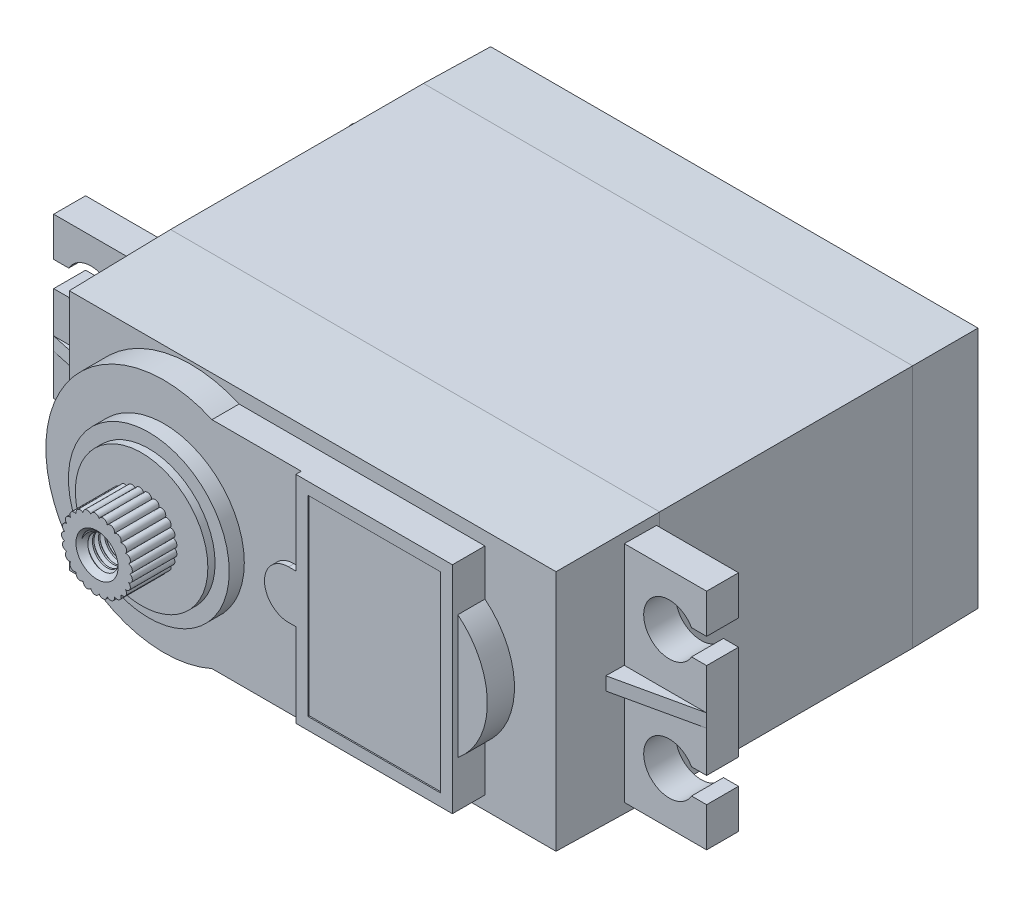
from build123d import *
from OCP.BRepFilletAPI import BRepFilletAPI_MakeChamfer

# Parameters (mm, degrees)
SKETCH1_W                 = 40.6
SKETCH1_H                 = 20.3
MAINCASE_DEPTH            = 37
FLANGE_START              = -5.6
FLANGE_DEPTH              = 2.65
TOPFACE_DEPTH             = 2.25
SKETCH2_3_R               = 6.675
BOSS_EXTRUDE4_DEPTH       = 3.5
SKETCH2_4_R               = 5.5
BOSS_EXTRUDE5_DEPTH       = 4.1
BOSS_EXTRUDE6_DEPTH       = 2.7
SKETCH2_8_W               = 11
SKETCH2_8_H               = 7.95
BOSS_EXTRUDE7_DEPTH       = 2.6
SKETCH3_R                 = 1.25
BOSS_EXTRUDE9_DEPTH       = 7.8
SKETCH3_4_R               = 1.25
BOSS_EXTRUDE10_DEPTH      = 3.7
BOSS_EXTRUDE11_DEPTH      = 0.55
BOSS_EXTRUDE11_DEPTH_BACK = 0.55
CHAMFER1_SIZE             = 0.5
THREAD1_PITCH             = 0.5
CHAMFER2_SIZE             = 7.5
CHAMFER2_SIZE2            = 0.1
CHAMFER3_SIZE             = 2
CHAMFER3_SIZE2            = 2.027207199
CHAMFER4_SIZE             = 8.5
CHAMFER4_SIZE_2           = 0.1
BOSS_EXTRUDE12_DEPTH      = 5
BOSS_EXTRUDE12_DEPTH_BACK = 1
BOSS_EXTRUDE13_DEPTH      = 8
CHAMFER5_SIZE             = 4
CHAMFER5_SIZE2            = 0.3


with BuildPart() as part:
    # Sketch1 → MainCase (new body)
    with BuildSketch(Plane.XY):
        with Locations((10.1, 0)):
            Rectangle(SKETCH1_W, SKETCH1_H)
    extrude(amount=-MAINCASE_DEPTH)

    # Sketch1<3> → Flange (add)
    with BuildSketch(Plane.XY.offset(FLANGE_START)):
        with BuildLine():
            Line((-17, 9.3), (37.2, 9.3))
            Line((37.2, 9.3), (37.2, 6.05))
            Line((37.2, 6.05), (35.947464479, 6.05))
            ThreePointArc((35.947464479, 6.05), (31.975, 5), (35.947464479, 3.95))
            Line((35.947464479, 3.95), (37.2, 3.95))
            Line((37.2, 3.95), (37.2, -3.95))
            Line((37.2, -3.95), (35.947464479, -3.95))
            ThreePointArc((35.947464479, -3.95), (31.975, -5), (35.947464479, -6.05))
            Line((35.947464479, -6.05), (37.2, -6.05))
            Line((37.2, -6.05), (37.2, -9.3))
            Line((37.2, -9.3), (-17, -9.3))
            Line((-17, -9.3), (-17, -6.05))
            Line((-17, -6.05), (-15.747464479, -6.05))
            ThreePointArc((-15.747464479, -6.05), (-11.775, -5), (-15.747464479, -3.95))
            Line((-15.747464479, -3.95), (-17, -3.95))
            Line((-17, -3.95), (-17, 3.95))
            Line((-17, 3.95), (-15.747464479, 3.95))
            ThreePointArc((-15.747464479, 3.95), (-11.775, 5), (-15.747464479, 6.05))
            Line((-15.747464479, 6.05), (-17, 6.05))
            Line((-17, 6.05), (-17, 9.3))
        make_face()
    extrude(amount=-FLANGE_DEPTH)

    # Sketch2 → TopFace (add)
    with BuildSketch(Plane.XY):
        with BuildLine():
            Line((3.992179856, 8.95), (24.4, 8.95))
            Line((24.4, 8.95), (24.4, 5.132007405))
            ThreePointArc((24.4, 5.132007405), (26.85, 0), (24.4, -5.132007405))
            Line((24.4, -5.132007405), (24.4, -8.95))
            Line((24.4, -8.95), (3.992179856, -8.95))
            ThreePointArc((3.992179856, -8.95), (-9.8, 0), (3.992179856, 8.95))
        make_face()
    extrude(amount=TOPFACE_DEPTH)

    # Sketch2<3> → Boss-Extrude4 (add)
    with BuildSketch(Plane.XY):
        Circle(SKETCH2_3_R)
    extrude(amount=BOSS_EXTRUDE4_DEPTH)

    # Sketch2<4> → Boss-Extrude5 (add)
    with BuildSketch(Plane.XY):
        Circle(SKETCH2_4_R)
    extrude(amount=BOSS_EXTRUDE5_DEPTH)

    # Sketch2<7> → Boss-Extrude6 (add)
    with BuildSketch(Plane.XY):
        with BuildLine():
            Line((24.4, 8.95), (11.4, 8.95))
            Line((11.4, 8.95), (11.4, 2))
            Line((11.4, 2), (10.8, 2))
            ThreePointArc((10.8, 2), (9.385786438, 1.414213562), (8.8, 0))
            Line((8.8, 0), (12.4, 0))
            Line((12.4, 0), (12.4, 7.95))
            Line((12.4, 7.95), (23.4, 7.95))
            Line((23.4, 7.95), (23.4, 0))
            Line((23.4, 0), (24.4, 0))
            Line((24.4, 0), (24.4, 5.132007405))
            Line((24.4, 5.132007405), (24.4, 8.95))
        make_face()
        with BuildLine():
            Line((11.4, -2), (11.4, -8.95))
            Line((11.4, -8.95), (24.4, -8.95))
            Line((24.4, -8.95), (24.4, -5.132007405))
            Line((24.4, -5.132007405), (24.4, 0))
            Line((24.4, 0), (23.4, 0))
            Line((23.4, 0), (23.4, -7.95))
            Line((23.4, -7.95), (12.4, -7.95))
            Line((12.4, -7.95), (12.4, 0))
            Line((12.4, 0), (8.8, 0))
            ThreePointArc((8.8, 0), (9.385786438, -1.414213562), (10.8, -2))
            Line((10.8, -2), (11.4, -2))
        make_face()
    extrude(amount=BOSS_EXTRUDE6_DEPTH)

    # Sketch2<8> → Boss-Extrude7 (add)
    with BuildSketch(Plane.XY):
        with Locations((17.9, 3.975)):
            Rectangle(SKETCH2_8_W, SKETCH2_8_H)
        with Locations((17.9, -3.975)):
            Rectangle(SKETCH2_8_W, SKETCH2_8_H)
    extrude(amount=BOSS_EXTRUDE7_DEPTH)

    # Sketch3 → Boss-Extrude9 (add)
    with BuildSketch(Plane.XY):
        with BuildLine():
            ThreePointArc((-2.678709694, 0.338399731), (-2.95, 0), (-2.678709694, -0.338399731))
            ThreePointArc((-2.678709694, -0.338399731), (-2.857320325, -0.733635167), (-2.510396512, -0.993936292))
            ThreePointArc((-2.510396512, -0.993936292), (-2.585104706, -1.421173339), (-2.184345885, -1.587020181))
            ThreePointArc((-2.184345885, -1.587020181), (-2.150457451, -2.019413962), (-1.721044772, -2.080385755))
            ThreePointArc((-1.721044772, -2.080385755), (-1.580689045, -2.49076738), (-1.149604087, -2.443033042))
            ThreePointArc((-1.149604087, -2.443033042), (-0.911600133, -2.805616723), (-0.505929549, -2.652175577))
            ThreePointArc((-0.505929549, -2.652175577), (-0.185232033, -2.944178849), (0.169534403, -2.694672167))
            ThreePointArc((0.169534403, -2.694672167), (0.552774878, -2.89774739), (0.834345885, -2.567852594))
            ThreePointArc((0.834345885, -2.567852594), (1.25604891, -2.669239805), (1.446732346, -2.279685399))
            ThreePointArc((1.446732346, -2.279685399), (1.88040077, -2.273014066), (1.968215294, -1.848277186))
            ThreePointArc((1.968215294, -1.848277186), (2.386600133, -1.733966494), (2.366028036, -1.30073492))
            ThreePointArc((2.366028036, -1.30073492), (2.742840633, -1.08596743), (2.615174535, -0.671462695))
            ThreePointArc((2.615174535, -0.671462695), (2.926738369, -0.369733039), (2.7, 0))
            ThreePointArc((2.7, 0), (2.926738369, 0.369733039), (2.615174535, 0.671462695))
            ThreePointArc((2.615174535, 0.671462695), (2.742840633, 1.08596743), (2.366028036, 1.30073492))
            ThreePointArc((2.366028036, 1.30073492), (2.386600133, 1.733966494), (1.968215294, 1.848277186))
            ThreePointArc((1.968215294, 1.848277186), (1.88040077, 2.273014066), (1.446732346, 2.279685399))
            ThreePointArc((1.446732346, 2.279685399), (1.25604891, 2.669239805), (0.834345885, 2.567852594))
            ThreePointArc((0.834345885, 2.567852594), (0.552774878, 2.89774739), (0.169534403, 2.694672167))
            ThreePointArc((0.169534403, 2.694672167), (-0.185232033, 2.944178849), (-0.505929549, 2.652175577))
            ThreePointArc((-0.505929549, 2.652175577), (-0.911600133, 2.805616723), (-1.149604087, 2.443033042))
            ThreePointArc((-1.149604087, 2.443033042), (-1.580689045, 2.49076738), (-1.721044772, 2.080385755))
            ThreePointArc((-1.721044772, 2.080385755), (-2.150457451, 2.019413962), (-2.184345885, 1.587020181))
            ThreePointArc((-2.184345885, 1.587020181), (-2.585104706, 1.421173339), (-2.510396512, 0.993936292))
            ThreePointArc((-2.510396512, 0.993936292), (-2.857320325, 0.733635167), (-2.678709694, 0.338399731))
        make_face()
        Circle(SKETCH3_R, mode=Mode.SUBTRACT)
    extrude(amount=BOSS_EXTRUDE9_DEPTH)

    # Sketch3<4> → Boss-Extrude10 (add)
    with BuildSketch(Plane.XY):
        Circle(SKETCH3_4_R)
    extrude(amount=BOSS_EXTRUDE10_DEPTH)

    # Sketch7 → Boss-Extrude11 (add, two sides: drawn at the far end of the back side and taken through both)
    with BuildSketch(Plane(origin=(0, 0, 0), x_dir=(1, 0, 0), z_dir=(0, 1, 0)).offset(-BOSS_EXTRUDE11_DEPTH_BACK)):
        Polygon((-17, 5.6), (37.2, 5.6), (30.4, 4.1), (-10.2, 4.1), align=None)
    extrude(amount=BOSS_EXTRUDE11_DEPTH + BOSS_EXTRUDE11_DEPTH_BACK)

    # Chamfer1
    chamfer1_edges = [part.edges().sort_by_distance(p)[0] for p in [
        (-1.25, 0, 7.8),
    ]]
    chamfer(chamfer1_edges, length=CHAMFER1_SIZE)

    # Thread1: the profile of Thread Profile1 profile screwed along a right-hand helix of 8 turns, 6 arcs to a turn; built about Z, then put on its axis
    thread1_z = Axis((0, 0, 0), (0, 0, 1))
    thread1_corners = [(1.2497, 0, -0.000173205), (1.520632938, 0, 0.156249999), (1.520632937, 0, 0.218749999), (1.2497, 0, 0.375173204)]
    with BuildLine(mode=Mode.PRIVATE) as thread1_profile:
        Line(thread1_corners[0], thread1_corners[1])
        Line(thread1_corners[1], thread1_corners[2])
        Line(thread1_corners[2], thread1_corners[3])
        Line(thread1_corners[3], thread1_corners[0])
    thread1_cap = Face(thread1_profile.wire())
    thread1_turn_angles = [0, 30, 60, 90, 120, 150, 180, 210, 240, 270, 300, 330, 360]
    thread1_turn_weights = [1, 0.8660254037844387, 1, 0.8660254037844387, 1, 0.8660254037844387, 1, 0.8660254037844387, 1, 0.8660254037844387, 1, 0.8660254037844387, 1]
    thread1_turn_rails = [Edge.make_bspline([Vector(p[0], p[1], 0).rotate(thread1_z, thread1_turn_angles[k]) / thread1_turn_weights[k] + Vector(0, 0, p[2] + THREAD1_PITCH * thread1_turn_angles[k] / 360) for k in range(13)], [0, 0, 0, 1, 1, 2, 2, 3, 3, 4, 4, 5, 5, 6, 6, 6], 2, thread1_turn_weights) for p in thread1_corners]
    thread1_turn_sides = [Face.make_surface_from_curves(thread1_turn_rails[p[0]], thread1_turn_rails[p[1]]) for p in [(0, 1), (1, 2), (2, 3), (3, 0)]]
    thread1 = Plane(origin=(0, 0, 8.3), x_dir=(-1, 0, 0), z_dir=(0, 0, -1)) * Solid(Shell([*[p.moved(Location((0, 0, THREAD1_PITCH * i))) for i in range(8) for p in thread1_turn_sides], thread1_cap, thread1_cap.rotate(thread1_z, 2880).moved(Location((0, 0, THREAD1_PITCH * 2880 / 360)))]))
    add(thread1, mode=Mode.SUBTRACT)

    # Chamfer2: one chamfer whose edges measure the first distance from different faces: ONE call of the kernel's chamfer builder (chamfer() names one face for all edges)
    chamfer2_edges_1 = [part.edges().sort_by_distance(p)[0] for p in [
        (10.1, -10.15, -37),
    ]]
    chamfer2_side_1 = [part.faces().sort_by_distance(p)[0] for p in [
        (10.1, -10.15, -18.5),
    ]]
    chamfer2_edges_2 = [part.edges().sort_by_distance(p)[0] for p in [
        (-10.2, 0, -37),
    ]]
    chamfer2_side_2 = [part.faces().sort_by_distance(p)[0] for p in [
        (-10.2, 0, -19.347026751),
    ]]
    chamfer2_edges_3 = [part.edges().sort_by_distance(p)[0] for p in [
        (10.1, 10.15, -37),
    ]]
    chamfer2_side_3 = [part.faces().sort_by_distance(p)[0] for p in [
        (10.1, 10.15, -18.5),
    ]]
    chamfer2_edges_4 = [part.edges().sort_by_distance(p)[0] for p in [
        (30.4, 0, -37),
    ]]
    chamfer2_side_4 = [part.faces().sort_by_distance(p)[0] for p in [
        (30.4, 0, -19.347026751),
    ]]
    chamfer2 = BRepFilletAPI_MakeChamfer(part.part.solid().wrapped)
    for e in chamfer2_edges_1:
        chamfer2.Add(CHAMFER2_SIZE, CHAMFER2_SIZE2, e.wrapped, chamfer2_side_1[0].wrapped)  # the first distance lies on this face
    for e in chamfer2_edges_2:
        chamfer2.Add(CHAMFER2_SIZE, CHAMFER2_SIZE2, e.wrapped, chamfer2_side_2[0].wrapped)  # the first distance lies on this face
    for e in chamfer2_edges_3:
        chamfer2.Add(CHAMFER2_SIZE, CHAMFER2_SIZE2, e.wrapped, chamfer2_side_3[0].wrapped)  # the first distance lies on this face
    for e in chamfer2_edges_4:
        chamfer2.Add(CHAMFER2_SIZE, CHAMFER2_SIZE2, e.wrapped, chamfer2_side_4[0].wrapped)  # the first distance lies on this face
    add(Compound.cast(chamfer2.Shape()), mode=Mode.REPLACE)

    # Chamfer3: one chamfer whose edges measure the first distance from different faces: ONE call of the kernel's chamfer builder (chamfer() names one face for all edges)
    chamfer3_edges_1 = [part.edges().sort_by_distance(p)[0] for p in [
        (10.1, 10.05, -37),
    ]]
    chamfer3_side_1 = [part.faces().sort_by_distance(p)[0] for p in [
        (10.1, 10.100041152, -33.24691358),
    ]]
    chamfer3_edges_2 = [part.edges().sort_by_distance(p)[0] for p in [
        (30.3, 0, -37),
    ]]
    chamfer3_side_2 = [part.faces().sort_by_distance(p)[0] for p in [
        (30.350082508, 0, -33.243811881),
    ]]
    chamfer3_edges_3 = [part.edges().sort_by_distance(p)[0] for p in [
        (10.1, -10.05, -37),
    ]]
    chamfer3_side_3 = [part.faces().sort_by_distance(p)[0] for p in [
        (10.1, -10.100041152, -33.24691358),
    ]]
    chamfer3_edges_4 = [part.edges().sort_by_distance(p)[0] for p in [
        (-10.1, 0, -37),
    ]]
    chamfer3_side_4 = [part.faces().sort_by_distance(p)[0] for p in [
        (-10.150082508, 0, -33.243811881),
    ]]
    chamfer3 = BRepFilletAPI_MakeChamfer(part.part.solid().wrapped)
    for e in chamfer3_edges_1:
        chamfer3.Add(CHAMFER3_SIZE, CHAMFER3_SIZE2, e.wrapped, chamfer3_side_1[0].wrapped)  # the first distance lies on this face
    for e in chamfer3_edges_2:
        chamfer3.Add(CHAMFER3_SIZE, CHAMFER3_SIZE2, e.wrapped, chamfer3_side_2[0].wrapped)  # the first distance lies on this face
    for e in chamfer3_edges_3:
        chamfer3.Add(CHAMFER3_SIZE, CHAMFER3_SIZE2, e.wrapped, chamfer3_side_3[0].wrapped)  # the first distance lies on this face
    for e in chamfer3_edges_4:
        chamfer3.Add(CHAMFER3_SIZE, CHAMFER3_SIZE2, e.wrapped, chamfer3_side_4[0].wrapped)  # the first distance lies on this face
    add(Compound.cast(chamfer3.Shape()), mode=Mode.REPLACE)

    # Chamfer4
    # the kernel refuses this chamfer: 8.5, 0.1 mm, written as the material it takes off along each edge
    with BuildSketch(Plane(origin=(-10.2, -32.249943445, 0), x_dir=(-0.0004524585348068341, 0, -0.9999998976406318), z_dir=(0, 1, 0))) as chamfer4_piece_1_section:
        Polygon((CHAMFER4_SIZE * 0.999999897641, -CHAMFER4_SIZE * 0.000452458534807), (-CHAMFER4_SIZE_2 * 0.000452458534807, -CHAMFER4_SIZE_2 * 0.999999897641), (0, 0), align=None)
    chamfer4_piece_1 = extrude(amount=64.499886889, mode=Mode.PRIVATE)
    chamfer4_piece_1 = split(chamfer4_piece_1, bisect_by=Plane(origin=(-10.199019608, -9.725, -8.25), z_dir=(0, 0, -1)), keep=Keep.TOP, mode=Mode.PRIVATE)
    add(chamfer4_piece_1, mode=Mode.SUBTRACT)
    with BuildSketch(Plane(origin=(-10.2, -32.249943445, 0), x_dir=(-0.0004524585348068341, 0, -0.9999998976406318), z_dir=(0, 1, 0))) as chamfer4_piece_2_section:
        Polygon((CHAMFER4_SIZE * 0.999999897641, -CHAMFER4_SIZE * 0.000452458534807), (-CHAMFER4_SIZE_2 * 0.000452458534807, -CHAMFER4_SIZE_2 * 0.999999897641), (0, 0), align=None)
    chamfer4_piece_2 = extrude(amount=64.499886889, mode=Mode.PRIVATE)
    chamfer4_piece_2 = split(chamfer4_piece_2, bisect_by=Plane(origin=(-10.188549642, -9.3, -6.553439153), z_dir=(0, -1, 0)), keep=Keep.TOP, mode=Mode.PRIVATE)
    add(chamfer4_piece_2, mode=Mode.SUBTRACT)
    with BuildSketch(Plane(origin=(-10.2, -32.249943445, 0), x_dir=(-0.0004524585348068341, 0, -0.9999998976406318), z_dir=(0, 1, 0))) as chamfer4_piece_3_section:
        Polygon((CHAMFER4_SIZE * 0.999999897641, -CHAMFER4_SIZE * 0.000452458534807), (-CHAMFER4_SIZE_2 * 0.000452458534807, -CHAMFER4_SIZE_2 * 0.999999897641), (0, 0), align=None)
    chamfer4_piece_3 = extrude(amount=64.499886889, mode=Mode.PRIVATE)
    chamfer4_piece_3 = split(chamfer4_piece_3, bisect_by=Plane(origin=(-10.178168705, -4.925, -5.6), z_dir=(0, 0, 1)), keep=Keep.TOP, mode=Mode.PRIVATE)
    chamfer4_piece_3 = split(chamfer4_piece_3, bisect_by=Plane(origin=(-10.178168705, -0.55, -4.795413493), z_dir=(0, -1, 0)), keep=Keep.TOP, mode=Mode.PRIVATE)
    add(chamfer4_piece_3, mode=Mode.SUBTRACT)
    with BuildSketch(Plane(origin=(-10.2, -32.249943445, 0), x_dir=(-0.0004524585348068341, 0, -0.9999998976406318), z_dir=(0, 1, 0))) as chamfer4_piece_4_section:
        Polygon((CHAMFER4_SIZE * 0.999999897641, -CHAMFER4_SIZE * 0.000452458534807), (-CHAMFER4_SIZE_2 * 0.000452458534807, -CHAMFER4_SIZE_2 * 0.999999897641), (0, 0), align=None)
    chamfer4_piece_4 = extrude(amount=64.499886889, mode=Mode.PRIVATE)
    chamfer4_piece_4 = split(chamfer4_piece_4, bisect_by=Plane(origin=(-9.685234905, 0, -3.986448876), z_dir=(-0.21540965591116212, 0, 0.9765237734639312)), keep=Keep.TOP, mode=Mode.PRIVATE)
    add(chamfer4_piece_4, mode=Mode.SUBTRACT)
    with BuildSketch(Plane(origin=(-10.2, -32.249943445, 0), x_dir=(-0.0004524585348068341, 0, -0.9999998976406318), z_dir=(0, 1, 0))) as chamfer4_piece_5_section:
        Polygon((CHAMFER4_SIZE * 0.999999897641, -CHAMFER4_SIZE * 0.000452458534807), (-CHAMFER4_SIZE_2 * 0.000452458534807, -CHAMFER4_SIZE_2 * 0.999999897641), (0, 0), align=None)
    chamfer4_piece_5 = extrude(amount=64.499886889, mode=Mode.PRIVATE)
    chamfer4_piece_5 = split(chamfer4_piece_5, bisect_by=Plane(origin=(-10.178168705, 4.925, -5.6), z_dir=(0, 0, 1)), keep=Keep.TOP, mode=Mode.PRIVATE)
    chamfer4_piece_5 = split(chamfer4_piece_5, bisect_by=Plane(origin=(-10.178168705, 0.55, -4.795413493), z_dir=(0, 1, 0)), keep=Keep.TOP, mode=Mode.PRIVATE)
    add(chamfer4_piece_5, mode=Mode.SUBTRACT)
    with BuildSketch(Plane(origin=(-10.2, -32.249943445, 0), x_dir=(-0.0004524585348068341, 0, -0.9999998976406318), z_dir=(0, 1, 0))) as chamfer4_piece_6_section:
        Polygon((CHAMFER4_SIZE * 0.999999897641, -CHAMFER4_SIZE * 0.000452458534807), (-CHAMFER4_SIZE_2 * 0.000452458534807, -CHAMFER4_SIZE_2 * 0.999999897641), (0, 0), align=None)
    chamfer4_piece_6 = extrude(amount=64.499886889, mode=Mode.PRIVATE)
    chamfer4_piece_6 = split(chamfer4_piece_6, bisect_by=Plane(origin=(-10.188549642, 9.3, -6.553439153), z_dir=(0, 1, 0)), keep=Keep.TOP, mode=Mode.PRIVATE)
    add(chamfer4_piece_6, mode=Mode.SUBTRACT)
    with BuildSketch(Plane(origin=(52.499943445, -10.15, 0), x_dir=(0, 0.2925221397698847, 0.956258750414577), z_dir=(-1, 0, 0))) as chamfer4_piece_7:
        Polygon((CHAMFER4_SIZE_2 * 0.29252213977, CHAMFER4_SIZE_2 * 0.956258750415), (-CHAMFER4_SIZE * 0.956258750415, CHAMFER4_SIZE * 0.29252213977), (0, 0), align=None)
    extrude(amount=84.799886889, mode=Mode.SUBTRACT)
    with BuildSketch(Plane(origin=(30.4, 32.249943445, 0), x_dir=(-0.2925221397698847, 0, 0.956258750414577), z_dir=(0, -1, 0))) as chamfer4_piece_8_section:
        Polygon((CHAMFER4_SIZE_2 * 0.29252213977, CHAMFER4_SIZE_2 * 0.956258750415), (-CHAMFER4_SIZE * 0.956258750415, CHAMFER4_SIZE * 0.29252213977), (0, 0), align=None)
    chamfer4_piece_8 = extrude(amount=64.499886889, mode=Mode.PRIVATE)
    chamfer4_piece_8 = split(chamfer4_piece_8, bisect_by=Plane(origin=(30.360776827, 9.725, -5.6), z_dir=(0, 0, 1)), keep=Keep.TOP, mode=Mode.PRIVATE)
    chamfer4_piece_8 = split(chamfer4_piece_8, bisect_by=Plane(origin=(30.360776827, 0.55, -1.83065883), z_dir=(0, 1, 0)), keep=Keep.TOP, mode=Mode.PRIVATE)
    add(chamfer4_piece_8, mode=Mode.SUBTRACT)
    with BuildSketch(Plane(origin=(30.4, 32.249943445, 0), x_dir=(-0.2925221397698847, 0, 0.956258750414577), z_dir=(0, -1, 0))) as chamfer4_piece_9_section:
        Polygon((CHAMFER4_SIZE_2 * 0.29252213977, CHAMFER4_SIZE_2 * 0.956258750415), (-CHAMFER4_SIZE * 0.956258750415, CHAMFER4_SIZE * 0.29252213977), (0, 0), align=None)
    chamfer4_piece_9 = extrude(amount=64.499886889, mode=Mode.PRIVATE)
    chamfer4_piece_9 = split(chamfer4_piece_9, bisect_by=Plane(origin=(30.388549642, 9.3, -6.553439153), z_dir=(0, 1, 0)), keep=Keep.TOP, mode=Mode.PRIVATE)
    add(chamfer4_piece_9, mode=Mode.SUBTRACT)
    with BuildSketch(Plane(origin=(30.4, 32.249943445, 0), x_dir=(-0.2925221397698847, 0, 0.956258750414577), z_dir=(0, -1, 0))) as chamfer4_piece_10_section:
        Polygon((CHAMFER4_SIZE_2 * 0.29252213977, CHAMFER4_SIZE_2 * 0.956258750415), (-CHAMFER4_SIZE * 0.956258750415, CHAMFER4_SIZE * 0.29252213977), (0, 0), align=None)
    chamfer4_piece_10 = extrude(amount=64.499886889, mode=Mode.PRIVATE)
    chamfer4_piece_10 = split(chamfer4_piece_10, bisect_by=Plane(origin=(29.885234905, 0, -3.986448876), z_dir=(0.2154096559111609, 0, 0.9765237734639313)), keep=Keep.TOP, mode=Mode.PRIVATE)
    add(chamfer4_piece_10, mode=Mode.SUBTRACT)
    with BuildSketch(Plane(origin=(30.4, 32.249943445, 0), x_dir=(-0.2925221397698847, 0, 0.956258750414577), z_dir=(0, -1, 0))) as chamfer4_piece_11_section:
        Polygon((CHAMFER4_SIZE_2 * 0.29252213977, CHAMFER4_SIZE_2 * 0.956258750415), (-CHAMFER4_SIZE * 0.956258750415, CHAMFER4_SIZE * 0.29252213977), (0, 0), align=None)
    chamfer4_piece_11 = extrude(amount=64.499886889, mode=Mode.PRIVATE)
    chamfer4_piece_11 = split(chamfer4_piece_11, bisect_by=Plane(origin=(30.399019608, 4.925, -8.25), z_dir=(0, 0, -1)), keep=Keep.TOP, mode=Mode.PRIVATE)
    add(chamfer4_piece_11, mode=Mode.SUBTRACT)
    with BuildSketch(Plane(origin=(30.4, 32.249943445, 0), x_dir=(-0.2925221397698847, 0, 0.956258750414577), z_dir=(0, -1, 0))) as chamfer4_piece_12_section:
        Polygon((CHAMFER4_SIZE_2 * 0.29252213977, CHAMFER4_SIZE_2 * 0.956258750415), (-CHAMFER4_SIZE * 0.956258750415, CHAMFER4_SIZE * 0.29252213977), (0, 0), align=None)
    chamfer4_piece_12 = extrude(amount=64.499886889, mode=Mode.PRIVATE)
    chamfer4_piece_12 = split(chamfer4_piece_12, bisect_by=Plane(origin=(30.378168705, -4.925, -5.6), z_dir=(0, 0, 1)), keep=Keep.TOP, mode=Mode.PRIVATE)
    chamfer4_piece_12 = split(chamfer4_piece_12, bisect_by=Plane(origin=(30.378168705, -0.55, -4.795413493), z_dir=(0, -1, 0)), keep=Keep.TOP, mode=Mode.PRIVATE)
    add(chamfer4_piece_12, mode=Mode.SUBTRACT)
    with BuildSketch(Plane(origin=(30.4, 32.249943445, 0), x_dir=(-0.2925221397698847, 0, 0.956258750414577), z_dir=(0, -1, 0))) as chamfer4_piece_13_section:
        Polygon((CHAMFER4_SIZE_2 * 0.29252213977, CHAMFER4_SIZE_2 * 0.956258750415), (-CHAMFER4_SIZE * 0.956258750415, CHAMFER4_SIZE * 0.29252213977), (0, 0), align=None)
    chamfer4_piece_13 = extrude(amount=64.499886889, mode=Mode.PRIVATE)
    chamfer4_piece_13 = split(chamfer4_piece_13, bisect_by=Plane(origin=(30.388549642, -9.3, -6.553439153), z_dir=(0, -1, 0)), keep=Keep.TOP, mode=Mode.PRIVATE)
    add(chamfer4_piece_13, mode=Mode.SUBTRACT)
    with BuildSketch(Plane(origin=(-32.299943445, 10.15, 0), x_dir=(0, 0.0004524585348068341, -0.9999998976406318), z_dir=(1, 0, 0))) as chamfer4_piece_14:
        Polygon((CHAMFER4_SIZE * 0.999999897641, -CHAMFER4_SIZE * 0.000452458534807), (-CHAMFER4_SIZE_2 * 0.000452458534807, -CHAMFER4_SIZE_2 * 0.999999897641), (0, 0), align=None)
    extrude(amount=84.799886889, mode=Mode.SUBTRACT)

    # Sketch8 → Boss-Extrude12 (add, two sides: drawn at the far end of the back side and taken through both)
    with BuildSketch(Plane.ZY.offset(10.2).offset(-BOSS_EXTRUDE12_DEPTH_BACK)):
        with BuildLine():
            Line((-30, 3.2), (-33, 3.2))
            ThreePointArc((-33, 3.2), (-33.353553391, 3.053553391), (-33.5, 2.7))
            Line((-33.5, 2.7), (-33.5, -2.7))
            ThreePointArc((-33.5, -2.7), (-33.353553391, -3.053553391), (-33, -3.2))
            Line((-33, -3.2), (-30, -3.2))
            ThreePointArc((-30, -3.2), (-29.646446609, -3.053553391), (-29.5, -2.7))
            Line((-29.5, -2.7), (-29.5, 2.7))
            ThreePointArc((-29.5, 2.7), (-29.646446609, 3.053553391), (-30, 3.2))
        make_face()
        with BuildLine():
            ThreePointArc((-31.692028644, 0.725), (-32.25, 0), (-31.692028644, -0.725))
            ThreePointArc((-31.692028644, -0.725), (-31.5, -2.2), (-31.307971356, -0.725))
            ThreePointArc((-31.307971356, -0.725), (-30.75, 0), (-31.307971356, 0.725))
            ThreePointArc((-31.307971356, 0.725), (-31.5, 2.2), (-31.692028644, 0.725))
        make_face(mode=Mode.SUBTRACT)
    extrude(amount=BOSS_EXTRUDE12_DEPTH + BOSS_EXTRUDE12_DEPTH_BACK)

    # Sketch8<2> → Boss-Extrude13 (add)
    with BuildSketch(Plane.ZY.offset(10.2)):
        with BuildLine():
            ThreePointArc((-31.692028644, -0.725), (-31.5, -2.2), (-31.307971356, -0.725))
            ThreePointArc((-31.307971356, -0.725), (-30.75, 0), (-31.307971356, 0.725))
            ThreePointArc((-31.307971356, 0.725), (-31.5, 2.2), (-31.692028644, 0.725))
            ThreePointArc((-31.692028644, 0.725), (-32.25, 0), (-31.692028644, -0.725))
        make_face()
    extrude(amount=BOSS_EXTRUDE13_DEPTH)

    # Chamfer5: one chamfer whose edges measure the first distance from different faces: ONE call of the kernel's chamfer builder (chamfer() names one face for all edges)
    chamfer5_edges_1 = [part.edges().sort_by_distance(p)[0] for p in [
        (-15.2, -3.053553391, -29.646446609),
    ]]
    chamfer5_side_1 = [part.faces().sort_by_distance(p)[0] for p in [
        (-12.696666667, -3.053553391, -29.646446609),
    ]]
    chamfer5_edges_2 = [part.edges().sort_by_distance(p)[0] for p in [
        (-15.2, 0, -29.5),
    ]]
    chamfer5_side_2 = [part.faces().sort_by_distance(p)[0] for p in [
        (-12.7, 0, -29.5),
    ]]
    chamfer5_edges_3 = [part.edges().sort_by_distance(p)[0] for p in [
        (-15.2, 3.053553391, -29.646446609),
    ]]
    chamfer5_side_3 = [part.faces().sort_by_distance(p)[0] for p in [
        (-12.696666667, 3.053553391, -29.646446609),
    ]]
    chamfer5_edges_4 = [part.edges().sort_by_distance(p)[0] for p in [
        (-15.2, 3.2, -31.5),
    ]]
    chamfer5_side_4 = [part.faces().sort_by_distance(p)[0] for p in [
        (-12.686653404, 3.2, -31.50198939),
    ]]
    chamfer5_edges_5 = [part.edges().sort_by_distance(p)[0] for p in [
        (-15.2, 3.053553391, -33.353553391),
    ]]
    chamfer5_side_5 = [part.faces().sort_by_distance(p)[0] for p in [
        (-12.673333333, 3.053553391, -33.353553391),
    ]]
    chamfer5_edges_6 = [part.edges().sort_by_distance(p)[0] for p in [
        (-15.2, 0, -33.5),
    ]]
    chamfer5_side_6 = [part.faces().sort_by_distance(p)[0] for p in [
        (-12.673333333, 0, -33.5),
    ]]
    chamfer5_edges_7 = [part.edges().sort_by_distance(p)[0] for p in [
        (-15.2, -3.053553391, -33.353553391),
    ]]
    chamfer5_side_7 = [part.faces().sort_by_distance(p)[0] for p in [
        (-12.673333333, -3.053553391, -33.353553391),
    ]]
    chamfer5_edges_8 = [part.edges().sort_by_distance(p)[0] for p in [
        (-15.2, -3.2, -31.5),
    ]]
    chamfer5_side_8 = [part.faces().sort_by_distance(p)[0] for p in [
        (-12.686653404, -3.2, -31.50198939),
    ]]
    chamfer5 = BRepFilletAPI_MakeChamfer(part.part.solid().wrapped)
    for e in chamfer5_edges_1:
        chamfer5.Add(CHAMFER5_SIZE, CHAMFER5_SIZE2, e.wrapped, chamfer5_side_1[0].wrapped)  # the first distance lies on this face
    for e in chamfer5_edges_2:
        chamfer5.Add(CHAMFER5_SIZE, CHAMFER5_SIZE2, e.wrapped, chamfer5_side_2[0].wrapped)  # the first distance lies on this face
    for e in chamfer5_edges_3:
        chamfer5.Add(CHAMFER5_SIZE, CHAMFER5_SIZE2, e.wrapped, chamfer5_side_3[0].wrapped)  # the first distance lies on this face
    for e in chamfer5_edges_4:
        chamfer5.Add(CHAMFER5_SIZE, CHAMFER5_SIZE2, e.wrapped, chamfer5_side_4[0].wrapped)  # the first distance lies on this face
    for e in chamfer5_edges_5:
        chamfer5.Add(CHAMFER5_SIZE, CHAMFER5_SIZE2, e.wrapped, chamfer5_side_5[0].wrapped)  # the first distance lies on this face
    for e in chamfer5_edges_6:
        chamfer5.Add(CHAMFER5_SIZE, CHAMFER5_SIZE2, e.wrapped, chamfer5_side_6[0].wrapped)  # the first distance lies on this face
    for e in chamfer5_edges_7:
        chamfer5.Add(CHAMFER5_SIZE, CHAMFER5_SIZE2, e.wrapped, chamfer5_side_7[0].wrapped)  # the first distance lies on this face
    for e in chamfer5_edges_8:
        chamfer5.Add(CHAMFER5_SIZE, CHAMFER5_SIZE2, e.wrapped, chamfer5_side_8[0].wrapped)  # the first distance lies on this face
    add(Compound.cast(chamfer5.Shape()), mode=Mode.REPLACE)


solid = part.part
